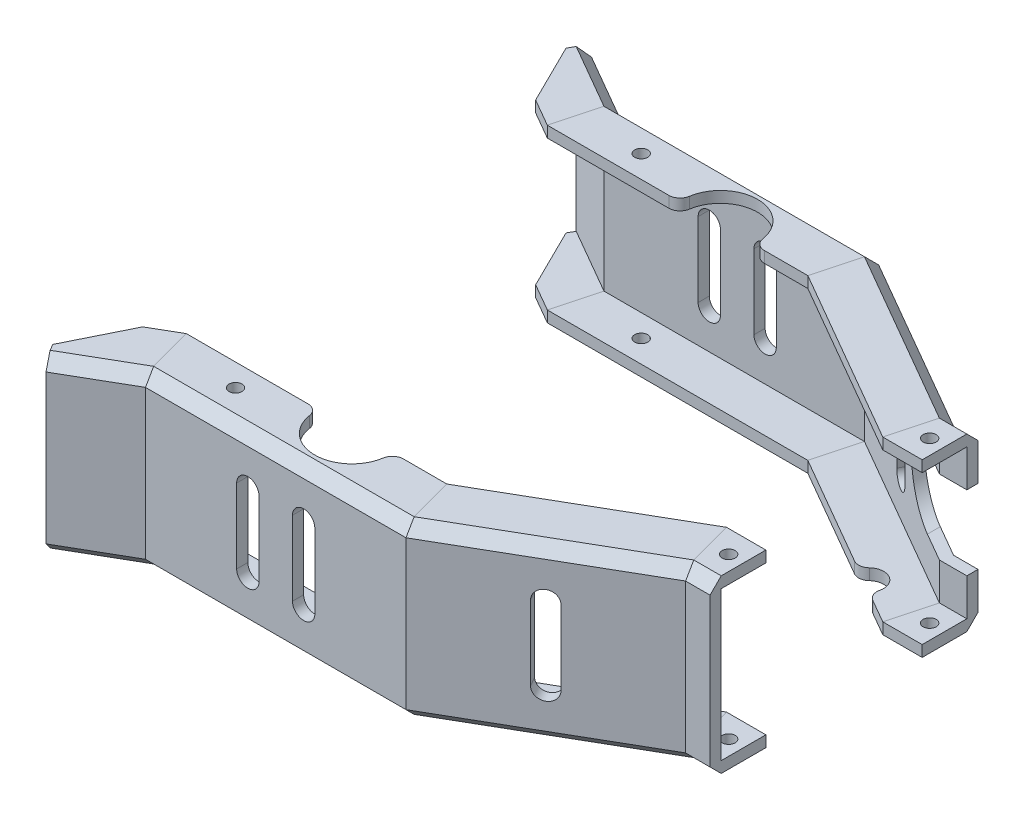
from build123d import *

# Parameters (mm, degrees)
CUT_EXTRUDE1_DEPTH         = 113.373698863
CUT_EXTRUDE3_DEPTH         = 5
CUT_EXTRUDE4_DEPTH         = 10
CHAMFER1_SIZE              = 3
CUT_EXTRUDE6_DEPTH         = 3
F_3_5_3_5_DIAMETER_HOLE1_D = 3.5
CUT_EXTRUDE9_DEPTH         = 10
CUT_EXTRUDE7_DEPTH         = 143.816147079
CUT_EXTRUDE7_DEPTH_BACK    = 5
FILLET1_R                  = 3
FILLET2_R                  = 3


with BuildPart() as part:
    # Sweep8: sweep along a path in Sketch6
    with BuildLine(Plane(origin=(0, 0, 0), x_dir=(1, 0, 0), z_dir=(0, 1, 0))) as sweep8_path:
        Line((-87.320508076, -10), (-70, 0))
        Line((-70, 0), (0, 0))
        Line((0, 0), (47.631397208, 27.5))
        Line((47.631397208, 27.5), (54.631397208, 27.5))
    # Sketch7 → Sweep8 (sweep)
    with BuildSketch(Plane(origin=(0, 0, 0), x_dir=(0, 0, -1), z_dir=(1, 0, 0))):
        Polygon((-1.604651163, -23), (-1.604651163, 23), (13.395348837, 23), (13.395348837, 20), (1.395348837, 20), (1.395348837, -20), (13.395348837, -20), (13.395348837, -23), align=None)
    sweep(path=sweep8_path.line, transition=Transition.RIGHT)

    # Sketch8 → Cut-Extrude1 (cut, through all)
    with BuildSketch(Plane(origin=(0, 23, 0), x_dir=(1, 0, 0), z_dir=(0, 1, 0))):
        Polygon((-89.018182494, -7.059541652), (-94.018182494, 1.600712386), (-81.027801438, 9.100712386), align=None)
    extrude(amount=-CUT_EXTRUDE1_DEPTH, mode=Mode.SUBTRACT)

    # Sketch10 → Cut-Extrude3 (cut)
    with BuildSketch(Plane(origin=(0, 23, 0), x_dir=(1, 0, 0), z_dir=(0, 1, 0))):
        with BuildLine():
            Line((-38.089272903, 13.395348837), (-18.089272903, 13.395348837))
            Line((-18.089272903, 13.395348837), (-18.089272903, 12.395348837))
            ThreePointArc((-18.089272903, 12.395348837), (-28.089272903, 2.395348837), (-38.089272903, 12.395348837))
            Line((-38.089272903, 12.395348837), (-38.089272903, 13.395348837))
        make_face()
    extrude(amount=-CUT_EXTRUDE3_DEPTH, mode=Mode.SUBTRACT)

    # Sketch11 → Cut-Extrude4 (cut)
    with BuildSketch(Plane.XY.offset(1.604651163)):
        with BuildLine():
            Line((-45.070035017, -10), (-45.070035017, 10))
            ThreePointArc((-45.070035017, 10), (-42.070035017, 13), (-39.070035017, 10))
            Line((-39.070035017, 10), (-39.070035017, -10))
            ThreePointArc((-39.070035017, -10), (-42.070035017, -13), (-45.070035017, -10))
        make_face()
        with BuildLine():
            Line((-24.070035017, -10), (-24.070035017, 10))
            ThreePointArc((-24.070035017, 10), (-27.070035017, 13), (-30.070035017, 10))
            Line((-30.070035017, 10), (-30.070035017, -10))
            ThreePointArc((-30.070035017, -10), (-27.070035017, -13), (-24.070035017, -10))
        make_face()
    extrude(amount=-CUT_EXTRUDE4_DEPTH, mode=Mode.SUBTRACT)

    # Chamfer1
    chamfer1_edges = [part.edges().sort_by_distance(p)[0] for p in [
        (-78.044108756, -23, 6.497159917),
        (-34.570035017, -23, 1.604651163),
        (24.245663587, -23, -12.145348837),
        (-78.044108756, 23, 6.497159917),
        (-34.570035017, 23, 1.604651163),
        (24.245663587, 23, -12.145348837),
        (51.3463797, -23, -25.895348837),
        (51.3463797, 23, -25.895348837),
    ]]
    chamfer(chamfer1_edges, length=CHAMFER1_SIZE)

    # Sketch14 → Cut-Extrude6 (cut)
    with BuildSketch(Plane(origin=(0.802325581, 0, 1.389668671), x_dir=(0.8660254037844379, 0, -0.5000000000000014), z_dir=(0.5000000000000014, 0, 0.8660254037844379))):
        with BuildLine():
            Line((24.070035017, -10), (24.070035017, 10))
            ThreePointArc((24.070035017, 10), (27.070035017, 13), (30.070035017, 10))
            Line((30.070035017, 10), (30.070035017, -10))
            ThreePointArc((30.070035017, -10), (27.070035017, -13), (24.070035017, -10))
        make_face()
    extrude(amount=-CUT_EXTRUDE6_DEPTH, mode=Mode.SUBTRACT)

    # Ø3.5 (3.5) Diameter Hole1 (through all)
    with Locations(Plane(origin=(0, -23, 0), x_dir=(-1, 0, 0), z_dir=(0, -1, 0))):
        with Locations((54.368602792, 7.395348837), (-50.631397208, 34.895348837)):
            Hole(F_3_5_3_5_DIAMETER_HOLE1_D / 2)

    # Sketch22 → Cut-Extrude9 (cut)
    with BuildSketch(Plane.XZ.offset(23)):
        with BuildLine():
            Line((28.953667037, -31.029323433), (28.453667037, -31.895348837))
            Line((28.453667037, -31.895348837), (35.381870267, -35.895348837))
            Line((35.381870267, -35.895348837), (35.881870267, -35.029323433))
            ThreePointArc((35.881870267, -35.029323433), (34.417768652, -29.565221818), (28.953667037, -31.029323433))
        make_face()
    extrude(amount=-CUT_EXTRUDE9_DEPTH, mode=Mode.SUBTRACT)


with BuildPart() as body_2:
    # Mirror2: mirrored copy
    add(part.part.mirror(Plane(origin=(0, 0, -61.895348837), x_dir=(1, 0, 0), z_dir=(0, 0, -1))))

    # Sketch20 → Cut-Extrude7 (cut, two sides: drawn at the far end of the back side and taken through both)
    with BuildSketch(Plane(origin=(0, 0, -97.895348837), x_dir=(-1, 0, 0), z_dir=(0, 0, -1)).offset(-CUT_EXTRUDE7_DEPTH_BACK)):
        with BuildLine():
            ThreePointArc((-39.631397208, -10), (-29.631397208, 0), (-39.631397208, 10))
            Line((-39.631397208, 10), (-54.631397208, 10))
            Line((-54.631397208, 10), (-54.631397208, -10))
            Line((-54.631397208, -10), (-39.631397208, -10))
        make_face()
    extrude(amount=CUT_EXTRUDE7_DEPTH + CUT_EXTRUDE7_DEPTH_BACK, mode=Mode.SUBTRACT)

    # Fillet2
    fillet2_edges = [body_2.edges().sort_by_distance(p)[0] for p in [
        (-38.089272903, 21.5, -110.395348837),
        (-18.089272903, 21.5, -110.395348837),
        (28.453667037, -21.5, -91.895348837),
        (35.381870267, -21.5, -87.895348837),
    ]]
    fillet(fillet2_edges, radius=FILLET2_R)


with BuildPart() as part_1:
    add(part.part)

    # Fillet1
    fillet1_edges = [part_1.edges().sort_by_distance(p)[0] for p in [
        (28.453667037, -21.5, -31.895348837),
        (35.381870267, -21.5, -35.895348837),
        (-18.089272903, 21.5, -13.395348837),
        (-38.089272903, 21.5, -13.395348837),
    ]]
    fillet(fillet1_edges, radius=FILLET1_R)


solid = Compound([body_2.part, part_1.part])
